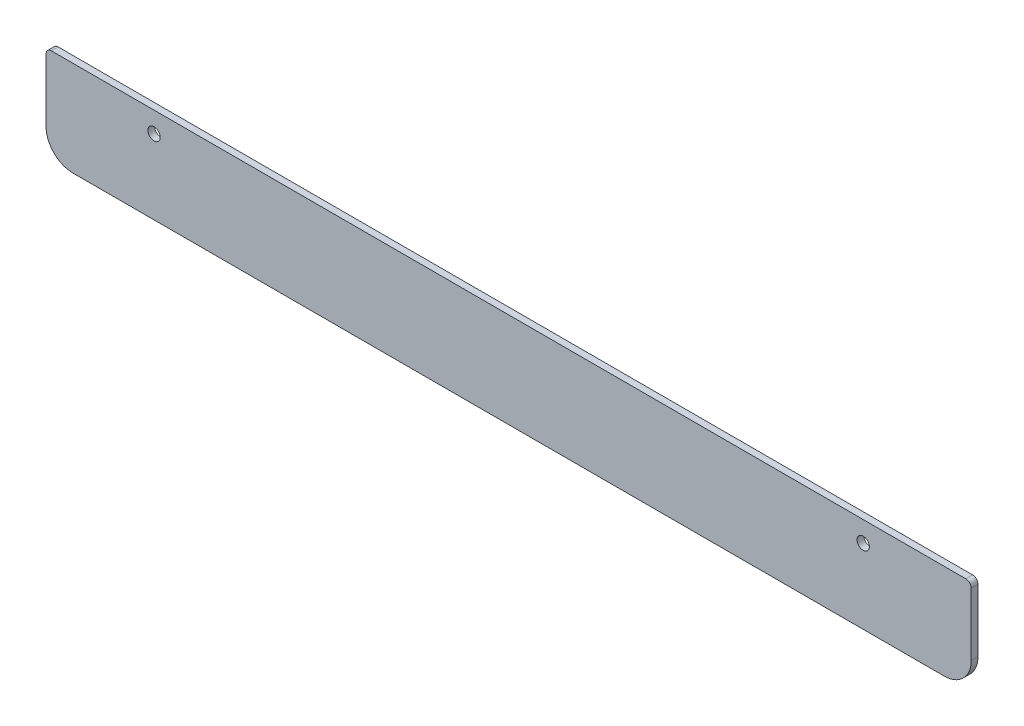
from build123d import *

# Parameters (mm, degrees)
SKETCH1_W                  = 434.975
SKETCH1_H                  = 44.704
BOSS_EXTRUDE1_DEPTH        = 3.175
FILLET1_R                  = 12.7
F_1_0_228_DIAMETER_HOLE1_D = 5.7912
FILLET2_R                  = 2.54


with BuildPart() as part:
    # Sketch1 → Boss-Extrude1 (new body)
    with BuildSketch(Plane.XY):
        Rectangle(SKETCH1_W, SKETCH1_H)
    extrude(amount=BOSS_EXTRUDE1_DEPTH)

    # Fillet1
    fillet1_edges = [part.edges().sort_by_distance(p)[0] for p in [
        (217.4875, -22.352, 1.5875),
        (-217.4875, -22.352, 1.5875),
    ]]
    fillet(fillet1_edges, radius=FILLET1_R)

    # #1 (0.228) Diameter Hole1 (through all)
    with Locations(Plane.XY.offset(3.175)):
        with Locations((166.6875, 12.7), (-166.6875, 12.7)):
            Hole(F_1_0_228_DIAMETER_HOLE1_D / 2)

    # Fillet2
    fillet2_edges = [part.edges().sort_by_distance(p)[0] for p in [
        (217.4875, 22.352, 1.5875),
        (-217.4875, 22.352, 1.5875),
    ]]
    fillet(fillet2_edges, radius=FILLET2_R)


solid = part.part
